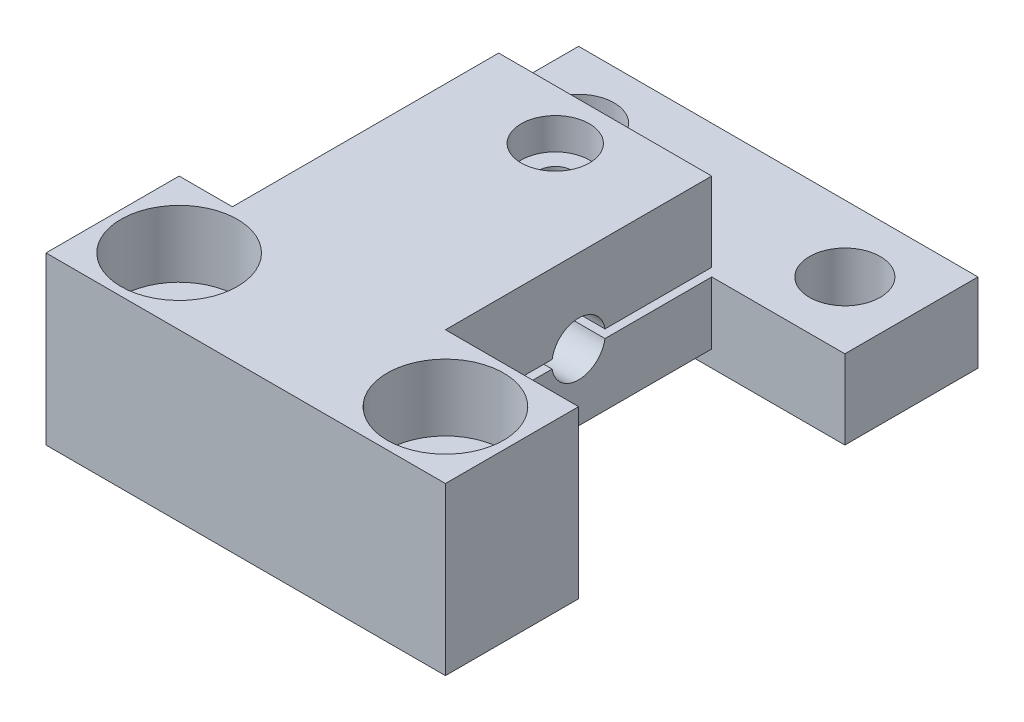
from build123d import *

# Parameters (mm, degrees)
SKETCH1_W                                        = 38.1
SKETCH1_H                                        = 50.8
EXTRUDE1_DEPTH                                   = 15.875
CBORE_FOR_1_4_SOCKET_HEAD_CAP_SCREW1_D           = 6.7564
CBORE_FOR_1_4_SOCKET_HEAD_CAP_SCREW1_CBORE_D     = 11.1125
CBORE_FOR_1_4_SOCKET_HEAD_CAP_SCREW1_CBORE_DEPTH = 6.35
SKETCH3_W                                        = 5.08
SKETCH3_H                                        = 25.4
SKETCH3_W_2                                      = 12.7
CUT_EXTRUDE2_DEPTH                               = 36.497579143
SKETCH5_W                                        = 20.32
SKETCH5_H                                        = 25.4
CUT_EXTRUDE4_DEPTH                               = 1.5875
F_1_4_20_TAPPED_HOLE1_D                          = 5.1054
SKETCH11_W                                       = 19.05
SKETCH11_H                                       = 0.79375
CUT_EXTRUDE5_DEPTH                               = 49.464271634
ADVANCEDHOLE1_START                              = 12.875
ADVANCEDHOLE1_OUTLINE_R                          = 3.25
ADVANCEDHOLE1_DEPTH                              = 3
ADVANCEDHOLE1_START_2                            = 1.5875
ADVANCEDHOLE1_2_OUTLINE_R                        = 1.25
ADVANCEDHOLE1_2_DEPTH                            = 11.2875
ADVANCEDHOLE1_START_3                            = 8.334375
ADVANCEDHOLE1_3_OUTLINE_R                        = 1.55
ADVANCEDHOLE1_3_OUTLINE_R_2                      = 1.25
ADVANCEDHOLE1_3_DEPTH                            = 4.540625


# Read off the part's stored shape, not the designer's step: AdvancedHole1
with BuildPart() as part:
    # Sketch1 → Extrude1 (new body)
    with BuildSketch(Plane(origin=(0, 0, 0), x_dir=(1, 0, 0), z_dir=(0, 1, 0))):
        Rectangle(SKETCH1_W, SKETCH1_H)
    extrude(amount=EXTRUDE1_DEPTH)

    # CBORE for 1/4 Socket Head Cap Screw1 (through all)
    with Locations(Plane(origin=(0, 15.875, 0), x_dir=(-1, 0, 0), z_dir=(0, 1, 0))):
        with Locations((12.7, -19.05), (-12.7, -19.05), (-12.7, 19.05), (12.7, 19.05)):
            CounterBoreHole(CBORE_FOR_1_4_SOCKET_HEAD_CAP_SCREW1_D / 2, CBORE_FOR_1_4_SOCKET_HEAD_CAP_SCREW1_CBORE_D / 2, CBORE_FOR_1_4_SOCKET_HEAD_CAP_SCREW1_CBORE_DEPTH)

    # Sketch3 → Cut-Extrude2 (cut, through all)
    with BuildSketch(Plane(origin=(0, 15.875, 0), x_dir=(-1, 0, 0), z_dir=(0, 1, 0))):
        with Locations((16.51, 0)):
            Rectangle(SKETCH3_W, SKETCH3_H)
        with Locations((-12.7, 0)):
            Rectangle(SKETCH3_W_2, SKETCH3_H)
    extrude(amount=-CUT_EXTRUDE2_DEPTH, mode=Mode.SUBTRACT)

    # Sketch5 → Cut-Extrude4 (cut)
    with BuildSketch(Plane.XZ):
        with Locations((-3.81, 0)):
            Rectangle(SKETCH5_W, SKETCH5_H)
    extrude(amount=-CUT_EXTRUDE4_DEPTH, mode=Mode.SUBTRACT)

    # 1/4-20 Tapped Hole1 (through all)
    with Locations(Plane.ZY.offset(13.97)):
        with Locations((0, 7.9375)):
            Hole(F_1_4_20_TAPPED_HOLE1_D / 2)

    # Sketch11 → Cut-Extrude5 (cut, through all)
    with BuildSketch(Plane(origin=(19.05, 0, 0), x_dir=(0, 0, -1), z_dir=(1, 0, 0))):
        Polygon((25.4, 7.540625), (25.4, 15.875), (12.7, 15.875), (12.7, 8.334375), (12.7, 7.540625), align=None)
        with Locations((3.175, 7.9375)):
            Rectangle(SKETCH11_W, SKETCH11_H)
    extrude(amount=-CUT_EXTRUDE5_DEPTH, mode=Mode.SUBTRACT)

    # AdvancedHole1 outline → AdvancedHole1 (cut)
    with BuildSketch(Plane(origin=(0, 0, 0), x_dir=(1, 0, 0), z_dir=(0, 1, 0)).offset(ADVANCEDHOLE1_START)):
        with Locations((-3.81, 7.9375)):
            Circle(ADVANCEDHOLE1_OUTLINE_R)
    extrude(amount=ADVANCEDHOLE1_DEPTH, mode=Mode.SUBTRACT)

    # AdvancedHole1 2 outline → AdvancedHole1 2 (cut)
    with BuildSketch(Plane(origin=(0, 0, 0), x_dir=(1, 0, 0), z_dir=(0, 1, 0)).offset(ADVANCEDHOLE1_START_2)):
        with Locations((-3.81, 7.9375)):
            Circle(ADVANCEDHOLE1_2_OUTLINE_R)
    extrude(amount=ADVANCEDHOLE1_2_DEPTH, mode=Mode.SUBTRACT)

    # AdvancedHole1 3 outline → AdvancedHole1 3 (cut)
    with BuildSketch(Plane(origin=(0, 0, 0), x_dir=(1, 0, 0), z_dir=(0, 1, 0)).offset(ADVANCEDHOLE1_START_3)):
        with Locations((-3.81, 7.9375)):
            Circle(ADVANCEDHOLE1_3_OUTLINE_R)
        with Locations((-3.81, 7.9375)):
            Circle(ADVANCEDHOLE1_3_OUTLINE_R_2, mode=Mode.SUBTRACT)
    extrude(amount=ADVANCEDHOLE1_3_DEPTH, mode=Mode.SUBTRACT)


solid = part.part
